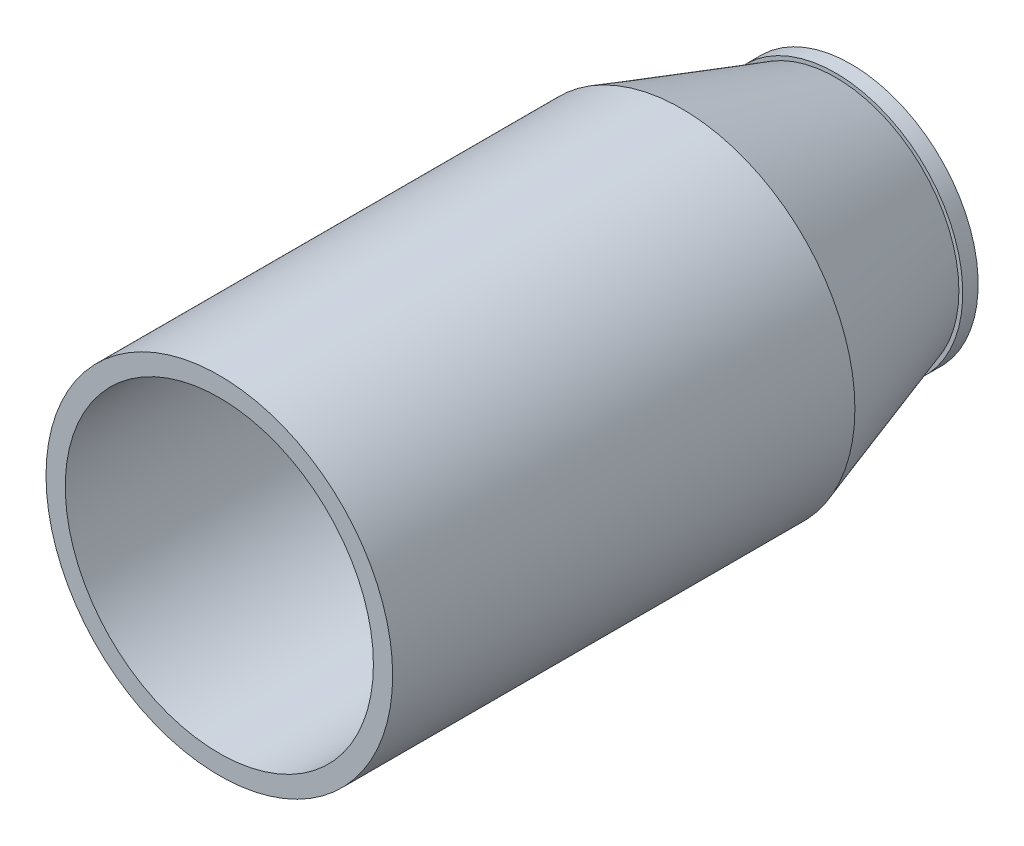
from build123d import *

# Parameters (mm, degrees)
SKETCH1_R           = 1125
SKETCH1_R_2         = 1000
BOSS_EXTRUDE1_DEPTH = 2000
CUT_EXTRUDE1_START  = -1200
SKETCH3_R           = 1000
CUT_EXTRUDE1_DEPTH  = 1200
SKETCH4_R           = 750
CUT_EXTRUDE2_DEPTH  = 1000
SKETCH5_R           = 825
SKETCH5_R_2         = 800
BOSS_EXTRUDE2_DEPTH = 100


with BuildPart() as part:
    # Sketch1 → Boss-Extrude1 (new body)
    with BuildSketch(Plane.XY):
        Circle(SKETCH1_R)
        Circle(SKETCH1_R_2, mode=Mode.SUBTRACT)
    extrude(amount=BOSS_EXTRUDE1_DEPTH)

    # Sketch2 → Revolve1 (revolve)
    with BuildSketch(Plane(origin=(0, 0, 0), x_dir=(0, 0, -1), z_dir=(1, 0, 0))):
        Polygon((0, 0), (2000, 0), (2000, -800), (1000, -1125), (0, -1125), align=None)
    revolve(axis=Axis((0, 0, 0), (0, 0, -1)))

    # Sketch3 → Cut-Extrude1 (cut)
    with BuildSketch(Plane.XY.offset(CUT_EXTRUDE1_START)):
        Circle(SKETCH3_R)
    extrude(amount=CUT_EXTRUDE1_DEPTH, mode=Mode.SUBTRACT)

    # Sketch4 → Cut-Extrude2 (cut)
    with BuildSketch(Plane(origin=(0, 0, -2000), x_dir=(-1, 0, 0), z_dir=(0, 0, -1))):
        Circle(SKETCH4_R)
    extrude(amount=-CUT_EXTRUDE2_DEPTH, mode=Mode.SUBTRACT)


with BuildPart() as body_2:
    # Sketch5 → Boss-Extrude2 (new body)
    with BuildSketch(Plane(origin=(0, 0, -2000), x_dir=(-1, 0, 0), z_dir=(0, 0, -1))):
        Circle(SKETCH5_R)
        Circle(SKETCH5_R_2, mode=Mode.SUBTRACT)
    extrude(amount=BOSS_EXTRUDE2_DEPTH)


solid = Compound([part.part, body_2.part])
